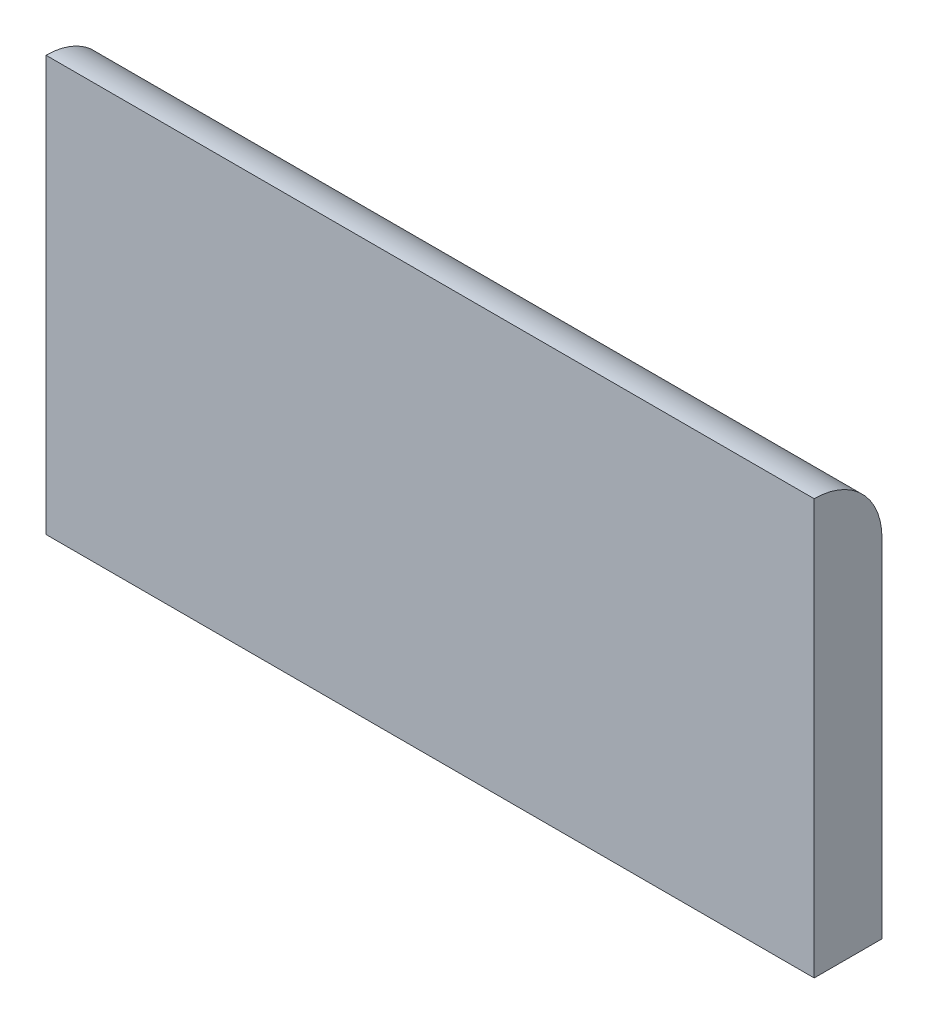
from build123d import *

# Parameters (mm, degrees)
SKETCH8_W           = 113.299968811
SKETCH8_H           = 61.218531535
BOSS_EXTRUDE6_DEPTH = 10
FILLET7_R           = 10


with BuildPart() as part:
    # Sketch8 → Boss-Extrude6 (new body)
    with BuildSketch(Plane.XY):
        with Locations((-35.943575618, 24.354623855)):
            Rectangle(SKETCH8_W, SKETCH8_H)
    extrude(amount=BOSS_EXTRUDE6_DEPTH)

    # Fillet7
    fillet7_edges = [part.edges().sort_by_distance(p)[0] for p in [
        (-35.943575617, 54.963889622, 0),
    ]]
    fillet(fillet7_edges, radius=FILLET7_R - 0.0001)  # a hair under: the kernel refuses the full size


solid = part.part
